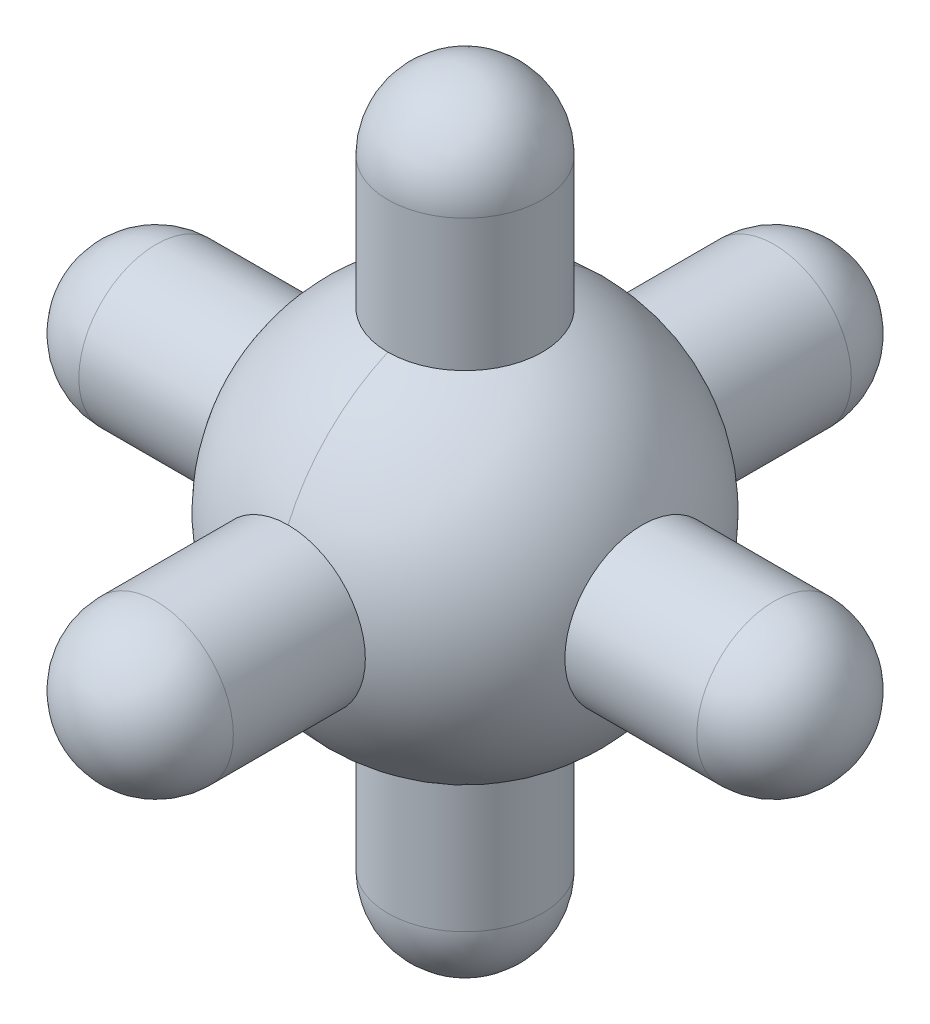
from build123d import *

# Parameters (mm, degrees)
SKETCH1_R           = 25
BOSS_EXTRUDE1_DEPTH = 25
FILLET1_R           = 25
SKETCH2_R           = 10
BOSS_EXTRUDE2_DEPTH = 50
FILLET2_R           = 10
SKETCH3_R           = 10
BOSS_EXTRUDE3_DEPTH = 50
FILLET3_R           = 10
SKETCH4_R           = 10
BOSS_EXTRUDE4_DEPTH = 50
FILLET4_R           = 10


with BuildPart() as part:
    # Sketch1 → Boss-Extrude1 (new, symmetric)
    with BuildSketch(Plane(origin=(0, 0, 0), x_dir=(0, 0, -1), z_dir=(1, 0, 0))):
        Circle(SKETCH1_R)
    extrude(amount=BOSS_EXTRUDE1_DEPTH, both=True)

    # Fillet1
    fillet1_edges = [part.edges().sort_by_distance(p)[0] for p in [
        (-25, 0, 25),
        (25, 0, 25),
    ]]
    fillet(fillet1_edges, radius=FILLET1_R - 0.0001)  # a hair under: the kernel refuses the full size

    # Sketch2 → Boss-Extrude2 (add, symmetric)
    with BuildSketch(Plane(origin=(0, 0, 0), x_dir=(0, 0, -1), z_dir=(1, 0, 0))):
        with Locations(Location((0, 0, 0), (0, 0, 180))):
            Circle(SKETCH2_R)
    extrude(amount=BOSS_EXTRUDE2_DEPTH, both=True)

    # Fillet2
    fillet2_edges = [part.edges().sort_by_distance(p)[0] for p in [
        (50, 0, -10),
        (-50, 0, -10),
    ]]
    fillet(fillet2_edges, radius=FILLET2_R)

    # Sketch3 → Boss-Extrude3 (add, symmetric)
    with BuildSketch(Plane.XY):
        with Locations(Location((0, 0, 0), (0, 0, 90))):
            Circle(SKETCH3_R)
    extrude(amount=BOSS_EXTRUDE3_DEPTH, both=True)

    # Fillet3
    fillet3_edges = [part.edges().sort_by_distance(p)[0] for p in [
        (0, -10, -50),
        (0, -10, 50),
    ]]
    fillet(fillet3_edges, radius=FILLET3_R)

    # Sketch4 → Boss-Extrude4 (add, symmetric)
    with BuildSketch(Plane(origin=(0, 0, 0), x_dir=(1, 0, 0), z_dir=(0, 1, 0))):
        with Locations(Location((0, 0, 0), (0, 0, 270))):
            Circle(SKETCH4_R)
    extrude(amount=BOSS_EXTRUDE4_DEPTH, both=True)

    # Fillet4
    fillet4_edges = [part.edges().sort_by_distance(p)[0] for p in [
        (0, -50, -10),
        (0, 50, -10),
    ]]
    fillet(fillet4_edges, radius=FILLET4_R)


solid = part.part
